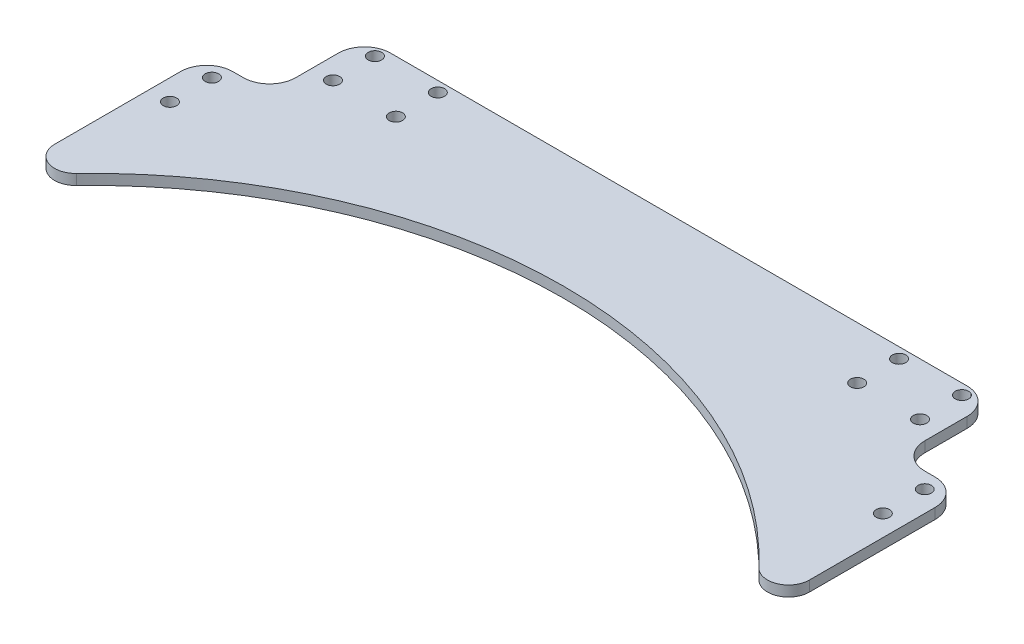
from build123d import *

# Parameters (mm, degrees)
BOSS_EXTRUDE1_DEPTH = 3.175
SKETCH3_R           = 2.032
CUT_EXTRUDE1_DEPTH  = 247.466724427
FILLET1_R           = 6.35
SKETCH4_W           = 19.05
SKETCH4_H           = 28.733872304
SKETCH4_W_2         = 19.050000004
SKETCH4_R           = 2.032
CUT_EXTRUDE2_DEPTH  = 247.466724427
FILLET2_R           = 7.9375


with BuildPart() as part:
    # Sketch1 → Boss-Extrude1 (new body)
    with BuildSketch(Plane(origin=(0, 0, 0), x_dir=(1, 0, 0), z_dir=(0, 1, 0))):
        with BuildLine():
            Line((0, 0), (0, 92.075))
            Line((0, 92.075), (228.6, 92.075))
            Line((228.6, 92.075), (228.6, 0))
            ThreePointArc((228.6, 0), (114.3, 57.15), (0, 0))
        make_face()
    extrude(amount=BOSS_EXTRUDE1_DEPTH)

    # Sketch3 → Cut-Extrude1 (cut, through all)
    with BuildSketch(Plane.XZ):
        with Locations((25.4, -88.9)):
            Circle(SKETCH3_R)
        with Locations((44.45, -88.9)):
            Circle(SKETCH3_R)
        with Locations((25.4, -76.2)):
            Circle(SKETCH3_R)
        with Locations((44.45, -76.2)):
            Circle(SKETCH3_R)
        with Locations((184.15, -88.9)):
            Circle(SKETCH3_R)
        with Locations((184.15, -76.2)):
            Circle(SKETCH3_R)
        with Locations((203.2, -76.2)):
            Circle(SKETCH3_R)
        with Locations((203.2, -88.9)):
            Circle(SKETCH3_R)
    extrude(amount=-CUT_EXTRUDE1_DEPTH, mode=Mode.SUBTRACT)

    # Fillet1
    fillet1_edges = [part.edges().sort_by_distance(p)[0] for p in [
        (0, 1.5875, 0),
        (228.6, 1.5875, 0),
    ]]
    fillet(fillet1_edges, radius=FILLET1_R)

    # Sketch4 → Cut-Extrude2 (cut, through all)
    with BuildSketch(Plane.XZ):
        with Locations((219.075, -77.708063848)):
            Rectangle(SKETCH4_W, SKETCH4_H)
        with Locations((9.525000002, -77.708063848)):
            Rectangle(SKETCH4_W_2, SKETCH4_H)
        with Locations((6.35, -45.878627696)):
            Circle(SKETCH4_R)
        with Locations((6.35, -58.578627696)):
            Circle(SKETCH4_R)
        with Locations((222.25, -45.878627696)):
            Circle(SKETCH4_R)
        with Locations((222.25, -58.578627696)):
            Circle(SKETCH4_R)
    extrude(amount=-CUT_EXTRUDE2_DEPTH, mode=Mode.SUBTRACT)

    # Fillet2
    fillet2_edges = [part.edges().sort_by_distance(p)[0] for p in [
        (209.55, 1.5875, -92.075),
        (209.55, 1.5875, -63.341127696),
        (228.6, 1.5875, -63.341127696),
        (19.050000004, 1.5875, -92.075),
        (19.050000004, 1.5875, -63.341127696),
        (0, 1.5875, -63.341127696),
    ]]
    fillet(fillet2_edges, radius=FILLET2_R)


solid = part.part
